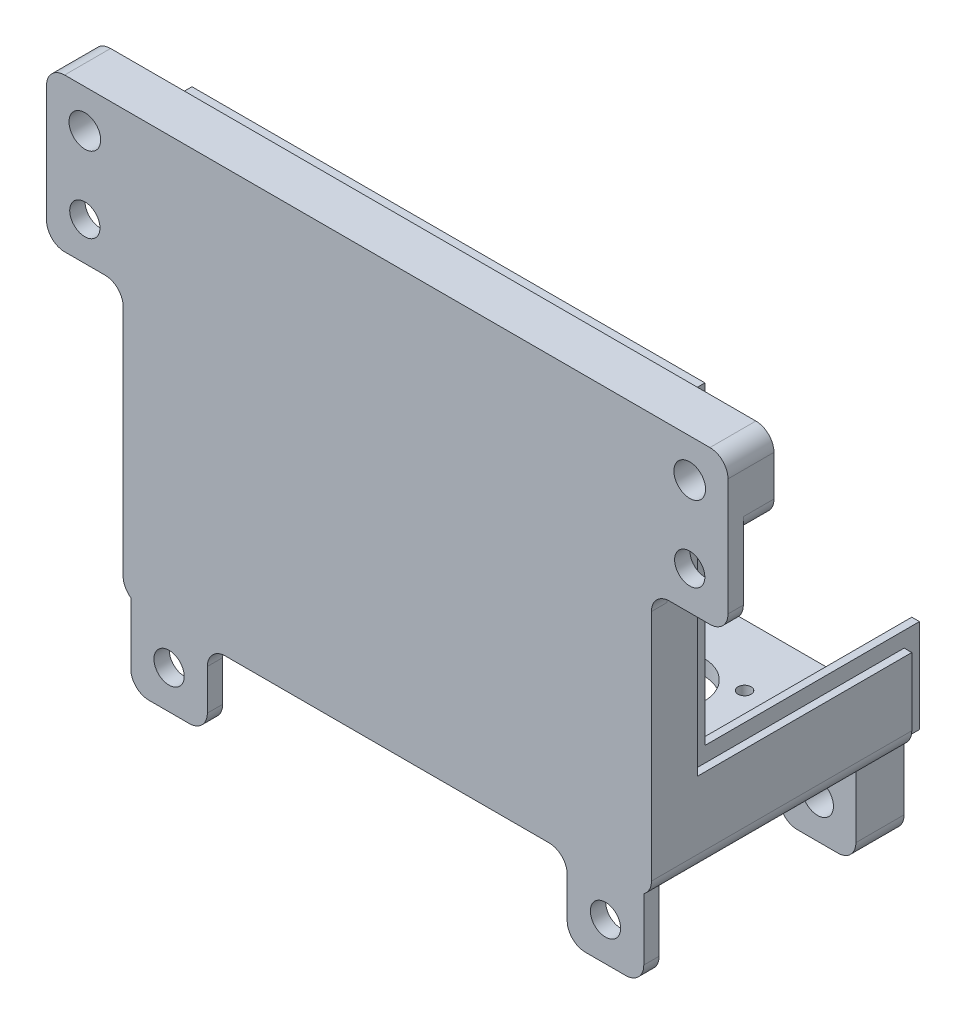
from build123d import *

# Parameters (mm, degrees)
SKETCH1_W           = 82.539998569
SKETCH1_H           = 65.04
BOSS_EXTRUDE1_DEPTH = 43.18
SHELL1_T            = 2.54
SKETCH2_R           = 1.085
CUT_EXTRUDE1_DEPTH  = 124.952130409
FILLET1_R           = 6.20014
FILLET2_R           = 1
SKETCH6_W           = 35.56
SKETCH6_H           = 50.8
CUT_EXTRUDE2_DEPTH  = 124.028758627
SKETCH3_R           = 2.125
BOSS_EXTRUDE2_DEPTH = 9.39038
CUT_EXTRUDE3_DEPTH  = 2.54
SKETCH8_W           = 1.27
SKETCH8_H           = 33.02
CUT_EXTRUDE4_DEPTH  = 2.54
SKETCH10_W          = 87.619998569
SKETCH10_H          = 10.145268184
BOSS_EXTRUDE3_DEPTH = 2.54
CUT_EXTRUDE5_DEPTH  = 2.54
SKETCH11_W          = 12.7
SKETCH11_H          = 8
BOSS_EXTRUDE4_DEPTH = 12.7
SKETCH12_R          = 2.625
CUT_EXTRUDE6_DEPTH  = 127.362400741
SKETCH13_W          = 7.62
SKETCH13_H          = 12.7
BOSS_EXTRUDE5_DEPTH = 12.7
SKETCH14_R          = 2.625
CUT_EXTRUDE7_DEPTH  = 125.717897357
SKETCH15_W          = 12.7
SKETCH15_H          = 12.7
SKETCH15_R          = 2.508000064
BOSS_EXTRUDE6_DEPTH = 2.54
FILLET3_R           = 3


# Some blends are built 0.0001 mm under size
with BuildPart() as part:
    # Sketch1 → Boss-Extrude1 (new body)
    with BuildSketch(Plane.XY):
        with Locations((47.599999189, 40.75)):
            Rectangle(SKETCH1_W, SKETCH1_H)
    extrude(amount=BOSS_EXTRUDE1_DEPTH)

    # Shell1
    shell1_openings = [part.faces().sort_by_distance(p)[0] for p in [
        (47.599999189, 73.27, 21.59),
        (47.599999189, 40.75, 0),
    ]]
    offset(amount=SHELL1_T, openings=shell1_openings, kind=Kind.INTERSECTION)

    # Sketch2 → Cut-Extrude1 (cut, through all)
    with BuildSketch(Plane(origin=(97.099998474, 5.69, 0), x_dir=(0, 0, -1), z_dir=(0, 1, 0))):
        with Locations(Location((-10.166, 73.199999285, 0), (0, 0, 90))):
            Circle(SKETCH2_R)
        with Locations(Location((-10.166, 25.799999285, 0), (0, 0, 90))):
            Circle(SKETCH2_R)
        with Locations(Location((-28.266, 24.299999285, 0), (0, 0, 90))):
            Circle(SKETCH2_R)
        with Locations(Location((-28.266, 74.699999285, 0), (0, 0, 90))):
            Circle(SKETCH2_R)
        Polygon((-33.02, 71.391050497), (-8.912, 71.391050497), (-8.912, 55.244166488), (-6.912, 55.244166488), (-6.912, 43.755832082), (-8.912, 43.755832082), (-8.912, 27.608948073), (-33.02, 27.608948073), align=None)
    extrude(amount=CUT_EXTRUDE1_DEPTH, mode=Mode.SUBTRACT)

    # Fillet1
    fillet1_edges = [part.edges().sort_by_distance(p)[0] for p in [
        (25.708947978, 6.96, 33.02),
        (69.491050401, 6.96, 33.02),
        (69.491050401, 6.96, 8.912),
        (25.708947978, 6.96, 8.912),
    ]]
    fillet(fillet1_edges, radius=FILLET1_R)

    # Fillet2
    fillet2_edges = [part.edges().sort_by_distance(p)[0] for p in [
        (53.344166393, 6.96, 6.912),
        (41.855831986, 6.96, 6.912),
    ]]
    fillet(fillet2_edges, radius=FILLET2_R)
    fillet2_2_edges = [part.edges().sort_by_distance(p)[0] for p in [
        (53.344166393, 6.96, 8.912),
        (41.855831986, 6.96, 8.912),
    ]]
    fillet(fillet2_2_edges, radius=FILLET2_R - 0.0001)  # a hair under: the kernel refuses the full size

    # Sketch6 → Cut-Extrude2 (cut, through all)
    with BuildSketch(Plane.ZY.offset(-3.789999905)):
        with Locations((17.78, 47.87)):
            Rectangle(SKETCH6_W, SKETCH6_H)
    extrude(amount=-CUT_EXTRUDE2_DEPTH, mode=Mode.SUBTRACT)

    # Sketch3 → Boss-Extrude2 (add)
    # profile 1 of 4: a face of its own
    with BuildSketch(Plane(origin=(0, 0, 43.18), x_dir=(-1, 0, 0), z_dir=(0, 0, -1))):
        with BuildLine():
            Line((-86.514394884, 72), (-78.685601874, 72))
            ThreePointArc((-78.685601874, 72), (-78.109870373, 62.509871885), (-87.599998474, 63.085603617))
            Line((-87.599998474, 63.085603617), (-87.599998474, 70.914396383))
            ThreePointArc((-87.599998474, 70.914396383), (-87.090126494, 71.490128006), (-86.514394884, 72))
        make_face()
        with Locations(Location((-82.599998379, 67, 0), (0, 0, 180))):
            Circle(SKETCH3_R, mode=Mode.SUBTRACT)
    # profile 2 of 4: a face of its own
    with BuildSketch(Plane(origin=(0, 0, 43.18), x_dir=(-1, 0, 0), z_dir=(0, 0, -1))):
        with BuildLine():
            Line((-7.599999905, 70.914398454), (-7.599999905, 63.085601546))
            ThreePointArc((-7.599999905, 63.085601546), (-17.090127314, 62.509872815), (-16.514394884, 72))
            Line((-16.514394884, 72), (-8.685601874, 72))
            ThreePointArc((-8.685601874, 72), (-8.109871193, 71.490128936), (-7.599999905, 70.914398454))
        make_face()
        with Locations(Location((-12.599998379, 67, 0), (0, 0, 180))):
            Circle(SKETCH3_R, mode=Mode.SUBTRACT)
    # profile 3 of 4: a face of its own
    with BuildSketch(Plane(origin=(0, 0, 43.18), x_dir=(-1, 0, 0), z_dir=(0, 0, -1))):
        with BuildLine():
            Line((-7.599999905, 20.914398454), (-7.599999905, 13.085601546))
            ThreePointArc((-7.599999905, 13.085601546), (-18.949998379, 17), (-7.599999905, 20.914398454))
        make_face()
        with Locations(Location((-12.599998379, 17, 0), (0, 0, 180))):
            Circle(SKETCH3_R, mode=Mode.SUBTRACT)
    # profile 4 of 4: a face of its own
    with BuildSketch(Plane(origin=(0, 0, 43.18), x_dir=(-1, 0, 0), z_dir=(0, 0, -1))):
        with BuildLine():
            Line((-87.599998474, 20.914396383), (-87.599998474, 13.085603617))
            ThreePointArc((-87.599998474, 13.085603617), (-76.249998379, 17), (-87.599998474, 20.914396383))
        make_face()
        with Locations(Location((-82.599998379, 17, 0), (0, 0, 180))):
            Circle(SKETCH3_R, mode=Mode.SUBTRACT)
    extrude(amount=BOSS_EXTRUDE2_DEPTH)

    # Sketch7 → Cut-Extrude3 (cut)
    with BuildSketch(Plane(origin=(0, 0, 0), x_dir=(-1, 0, 0), z_dir=(0, 0, -1))):
        Polygon((-91.409998474, 22.47), (-90.139998474, 22.47), (-90.139998474, 6.96), (-5.059999905, 6.96), (-5.059999905, 22.47), (-3.789999905, 22.47), (-3.789999905, 5.69), (-91.409998474, 5.69), align=None)
    extrude(amount=-CUT_EXTRUDE3_DEPTH, mode=Mode.SUBTRACT)

    # Sketch8 → Cut-Extrude4 (cut)
    with BuildSketch(Plane(origin=(0, 22.47, 0), x_dir=(1, 0, 0), z_dir=(0, 1, 0))):
        with Locations((4.424999905, -19.05)):
            Rectangle(SKETCH8_W, SKETCH8_H)
        with Locations((90.774998474, -19.05)):
            Rectangle(SKETCH8_W, SKETCH8_H)
    extrude(amount=-CUT_EXTRUDE4_DEPTH, mode=Mode.SUBTRACT)

    # Sketch10 → Boss-Extrude3 (add)
    with BuildSketch(Plane(origin=(0, 73.27, 0), x_dir=(1, 0, 0), z_dir=(0, 1, 0))):
        with Locations((47.59999919, -40.647365908)):
            Rectangle(SKETCH10_W, SKETCH10_H)
    extrude(amount=BOSS_EXTRUDE3_DEPTH)

    # Sketch9 → Cut-Extrude5 (cut)
    with BuildSketch(Plane(origin=(0, 0, 35.56), x_dir=(-1, 0, 0), z_dir=(0, 0, -1))):
        Polygon((-90.139998474, 73.27), (-90.139998474, 74.54), (-5.059999905, 74.54), (-5.059999905, 73.27), (-5.059999905, 19.93), (-3.789999905, 19.93), (-3.789999905, 73.27), (-3.789999905, 75.81), (-91.409998474, 75.81), (-91.409998474, 73.27), (-91.409998474, 19.93), (-90.139998474, 19.93), align=None)
    extrude(amount=-CUT_EXTRUDE5_DEPTH, mode=Mode.SUBTRACT)

    # Sketch11 → Boss-Extrude4 (add)
    with BuildSketch(Plane.XZ.offset(-5.69)):
        with Locations((83.789998474, 6.54)):
            Rectangle(SKETCH11_W, SKETCH11_H)
        with Locations((11.409999905, 6.54)):
            Rectangle(SKETCH11_W, SKETCH11_H)
    extrude(amount=BOSS_EXTRUDE4_DEPTH)

    # Sketch12 → Cut-Extrude6 (cut, through all)
    with BuildSketch(Plane(origin=(0, 0, 2.54), x_dir=(-1, 0, 0), z_dir=(0, 0, -1))):
        with Locations((-83.789998474, -0.66)):
            Circle(SKETCH12_R)
        with Locations((-11.409999905, -0.66)):
            Circle(SKETCH12_R)
    extrude(amount=-CUT_EXTRUDE6_DEPTH, mode=Mode.SUBTRACT)

    # Sketch13 → Boss-Extrude5 (add)
    with BuildSketch(Plane.ZY.offset(-3.789999905)):
        with Locations((41.91, 69.46)):
            Rectangle(SKETCH13_W, SKETCH13_H)
    boss_extrude5 = extrude(amount=BOSS_EXTRUDE5_DEPTH)

    # Sketch14 → Cut-Extrude7 (cut, through all)
    with BuildSketch(Plane(origin=(0, 0, 38.1), x_dir=(-1, 0, 0), z_dir=(0, 0, -1))):
        with Locations(Location((2.560000095, 69.46, 0), (0, 0, 90))):
            Circle(SKETCH14_R)
    cut_extrude7 = extrude(amount=-CUT_EXTRUDE7_DEPTH, mode=Mode.SUBTRACT)

    # Mirror1: Boss-Extrude5, Cut-Extrude7 across plane
    add(boss_extrude5.mirror(Plane.ZY.offset(-47.599999189)))
    add(cut_extrude7.mirror(Plane.ZY.offset(-47.599999189)), mode=Mode.SUBTRACT)

    # Sketch15 → Boss-Extrude6 (add)
    # profile 1 of 4: a face of its own
    with BuildSketch(Plane.XY.offset(45.72)):
        with Locations((11.409999905, -0.66)):
            Rectangle(SKETCH15_W, SKETCH15_H)
        with Locations((11.409999905, -0.66)):
            Circle(SKETCH15_R, mode=Mode.SUBTRACT)
    # profile 2 of 4: a face of its own
    with BuildSketch(Plane.XY.offset(45.72)):
        with Locations((83.789998474, -0.66)):
            Rectangle(SKETCH15_W, SKETCH15_H)
        with Locations((83.789998474, -0.66)):
            Circle(SKETCH15_R, mode=Mode.SUBTRACT)
    # profile 3 of 4: a face of its own
    with BuildSketch(Plane.XY.offset(45.72)):
        with Locations((-2.560000095, 56.76)):
            Rectangle(SKETCH15_W, SKETCH15_H)
        with Locations((-2.560000095, 56.76)):
            Circle(SKETCH15_R, mode=Mode.SUBTRACT)
    # profile 4 of 4: a face of its own
    with BuildSketch(Plane.XY.offset(45.72)):
        with Locations((97.759998474, 56.76)):
            Rectangle(SKETCH15_W, SKETCH15_H)
        with Locations((97.759998474, 56.76)):
            Circle(SKETCH15_R, mode=Mode.SUBTRACT)
    extrude(amount=-BOSS_EXTRUDE6_DEPTH)

    # Fillet3
    # the kernel refuses this fillet: 3 mm, written as the material it adds along each edge
    with BuildSketch(Plane(origin=(6.329999905, 73.27, 35.574731816), x_dir=(1, 0, 0), z_dir=(0, 0, 1))) as fillet3_piece_1:
        with BuildLine():
            CenterArc((FILLET3_R, -FILLET3_R), FILLET3_R, 90, 90)
            Line((0, -FILLET3_R), (0, 0))
            Line((0, 0), (FILLET3_R, 0))
        make_face()
    extrude(amount=7.605268184)
    with BuildSketch(Plane(origin=(88.869998474, 73.27, 35.574731816), x_dir=(-1, 0, 0), z_dir=(0, 0, 1))) as fillet3_piece_2:
        with BuildLine():
            CenterArc((FILLET3_R, FILLET3_R), FILLET3_R, 180, 90)
            Line((0, FILLET3_R), (0, 0))
            Line((0, 0), (FILLET3_R, 0))
        make_face()
    extrude(amount=7.605268184)
    with BuildSketch(Plane(origin=(88.869998474, 8.23, 0), x_dir=(-1, 0, 0), z_dir=(0, 0, 1))) as fillet3_piece_3:
        with BuildLine():
            CenterArc((FILLET3_R, -FILLET3_R), FILLET3_R, 90, 90)
            Line((0, -FILLET3_R), (0, 0))
            Line((0, 0), (FILLET3_R, 0))
        make_face()
    extrude(amount=43.18)
    with BuildSketch(Plane(origin=(6.329999905, 8.23, 0), x_dir=(1, 0, 0), z_dir=(0, 0, 1))) as fillet3_piece_4:
        with BuildLine():
            CenterArc((FILLET3_R, FILLET3_R), FILLET3_R, 180, 90)
            Line((0, FILLET3_R), (0, 0))
            Line((0, 0), (FILLET3_R, 0))
        make_face()
    extrude(amount=43.18)
    with BuildSketch(Plane(origin=(3.789999905, 63.11, 43.18), x_dir=(-1, 0, 0), z_dir=(0, 0, -1))) as fillet3_piece_5:
        with BuildLine():
            CenterArc((FILLET3_R, -FILLET3_R), FILLET3_R, 90, 90)
            Line((0, -FILLET3_R), (0, 0))
            Line((0, 0), (FILLET3_R, 0))
        make_face()
    extrude(amount=5.08)
    with BuildSketch(Plane(origin=(3.789999905, 50.41, 45.72), x_dir=(-1, 0, 0), z_dir=(0, 0, -1)), Plane(origin=(77.439998474, 5.69, 45.72), x_dir=(-1, 0, 0), z_dir=(0, 0, -1))) as fillet3_piece_6:
        with BuildLine():
            CenterArc((FILLET3_R, -FILLET3_R), FILLET3_R, 90, 90)
            Line((0, -FILLET3_R), (0, 0))
            Line((0, 0), (FILLET3_R, 0))
        make_face()
    extrude(amount=2.54)
    with BuildSketch(Plane(origin=(17.759999905, 5.69, 10.54), x_dir=(1, 0, 0), z_dir=(0, 0, -1))) as fillet3_piece_7:
        with BuildLine():
            CenterArc((FILLET3_R, FILLET3_R), FILLET3_R, 180, 90)
            Line((0, FILLET3_R), (0, 0))
            Line((0, 0), (FILLET3_R, 0))
        make_face()
    extrude(amount=8)
    with BuildSketch(Plane(origin=(77.439998474, 5.69, 10.54), x_dir=(-1, 0, 0), z_dir=(0, 0, -1))) as fillet3_piece_8:
        with BuildLine():
            CenterArc((FILLET3_R, -FILLET3_R), FILLET3_R, 90, 90)
            Line((0, -FILLET3_R), (0, 0))
            Line((0, 0), (FILLET3_R, 0))
        make_face()
    extrude(amount=8)
    with BuildSketch(Plane(origin=(17.759999905, 5.69, 45.72), x_dir=(1, 0, 0), z_dir=(0, 0, -1)), Plane(origin=(91.409998474, 50.41, 45.72), x_dir=(1, 0, 0), z_dir=(0, 0, -1))) as fillet3_piece_9:
        with BuildLine():
            CenterArc((FILLET3_R, FILLET3_R), FILLET3_R, 180, 90)
            Line((0, FILLET3_R), (0, 0))
            Line((0, 0), (FILLET3_R, 0))
        make_face()
    extrude(amount=2.54)
    with BuildSketch(Plane(origin=(91.409998474, 63.11, 43.18), x_dir=(1, 0, 0), z_dir=(0, 0, -1))) as fillet3_piece_10:
        with BuildLine():
            CenterArc((FILLET3_R, FILLET3_R), FILLET3_R, 180, 90)
            Line((0, FILLET3_R), (0, 0))
            Line((0, 0), (FILLET3_R, 0))
        make_face()
    extrude(amount=5.08)
    # the kernel refuses this fillet: 3 mm, written as the material it takes off along each edge
    with BuildSketch(Plane(origin=(-8.910000095, 75.81, 30.6), x_dir=(1, 0, 0), z_dir=(0, 0, 1)), Plane(origin=(104.109998474, 75.81, 30.6), x_dir=(0, -1, 0), z_dir=(0, 0, 1))) as fillet3_2_piece_1:
        with BuildLine():
            CenterArc((FILLET3_R, -FILLET3_R), FILLET3_R, 90, 90)
            Line((0, -FILLET3_R), (0, 0))
            Line((0, 0), (FILLET3_R, 0))
        make_face()
    extrude(amount=22.62, mode=Mode.SUBTRACT)
    with BuildSketch(Plane(origin=(-8.910000095, 63.11, 43.18), x_dir=(0, 1, 0), z_dir=(0, 0, -1)), Plane(origin=(104.109998474, 63.11, 43.18), x_dir=(-1, 0, 0), z_dir=(0, 0, -1))) as fillet3_2_piece_2:
        with BuildLine():
            CenterArc((FILLET3_R, FILLET3_R), FILLET3_R, 180, 90)
            Line((0, FILLET3_R), (0, 0))
            Line((0, 0), (FILLET3_R, 0))
        make_face()
    extrude(amount=12.58, mode=Mode.SUBTRACT)
    with BuildSketch(Plane(origin=(-8.910000095, 50.41, 53.22), x_dir=(0, 1, 0), z_dir=(0, 0, -1)), Plane(origin=(17.759999905, -7.01, 53.22), x_dir=(-1, 0, 0), z_dir=(0, 0, -1)), Plane(origin=(5.059999905, -7.01, 53.22), x_dir=(0, 1, 0), z_dir=(0, 0, -1)), Plane(origin=(77.439998474, -7.01, 53.22), x_dir=(0, 1, 0), z_dir=(0, 0, -1)), Plane(origin=(90.139998474, -7.01, 53.22), x_dir=(-1, 0, 0), z_dir=(0, 0, -1)), Plane(origin=(104.109998474, 50.41, 53.22), x_dir=(-1, 0, 0), z_dir=(0, 0, -1))) as fillet3_2_piece_3:
        with BuildLine():
            CenterArc((FILLET3_R, FILLET3_R), FILLET3_R, 180, 90)
            Line((0, FILLET3_R), (0, 0))
            Line((0, 0), (FILLET3_R, 0))
        make_face()
    extrude(amount=17.54, mode=Mode.SUBTRACT)
    with BuildSketch(Plane(origin=(17.759999905, -7.01, 18.04), x_dir=(0, 1, 0), z_dir=(0, 0, -1)), Plane(origin=(77.439998474, -7.01, 18.04), x_dir=(1, 0, 0), z_dir=(0, 0, -1))) as fillet3_2_piece_4:
        with BuildLine():
            CenterArc((FILLET3_R, -FILLET3_R), FILLET3_R, 90, 90)
            Line((0, -FILLET3_R), (0, 0))
            Line((0, 0), (FILLET3_R, 0))
        make_face()
    extrude(amount=23, mode=Mode.SUBTRACT)
    with BuildSketch(Plane(origin=(5.059999905, -7.01, -4.96), x_dir=(1, 0, 0), z_dir=(0, 0, 1)), Plane(origin=(90.139998474, -7.01, -4.96), x_dir=(0, 1, 0), z_dir=(0, 0, 1))) as fillet3_2_piece_5:
        with BuildLine():
            CenterArc((FILLET3_R, FILLET3_R), FILLET3_R, 180, 90)
            Line((0, FILLET3_R), (0, 0))
            Line((0, 0), (FILLET3_R, 0))
        make_face()
    extrude(amount=23, mode=Mode.SUBTRACT)
    with BuildSketch(Plane(origin=(3.789999905, 5.69, 53.22), x_dir=(1, 0, 0), z_dir=(0, 0, -1))) as fillet3_2_piece_6_section:
        with BuildLine():
            CenterArc((FILLET3_R, -FILLET3_R), FILLET3_R, 90, 90)
            Line((0, -FILLET3_R), (0, 0))
            Line((0, 0), (FILLET3_R, 0))
        make_face()
    fillet3_2_piece_6 = extrude(amount=58.18, mode=Mode.PRIVATE)
    fillet3_2_piece_6 = split(fillet3_2_piece_6, bisect_by=Plane(origin=(5.059999905, 6.455077562, 44.45), z_dir=(-1, 0, 0)), keep=Keep.TOP, mode=Mode.PRIVATE)
    add(fillet3_2_piece_6, mode=Mode.SUBTRACT)
    with BuildSketch(Plane(origin=(3.789999905, 5.69, 53.22), x_dir=(1, 0, 0), z_dir=(0, 0, -1))) as fillet3_2_piece_7_section:
        with BuildLine():
            CenterArc((FILLET3_R, -FILLET3_R), FILLET3_R, 90, 90)
            Line((0, -FILLET3_R), (0, 0))
            Line((0, 0), (FILLET3_R, 0))
        make_face()
    fillet3_2_piece_7 = extrude(amount=58.18, mode=Mode.PRIVATE)
    fillet3_2_piece_7 = split(fillet3_2_piece_7, bisect_by=Plane(origin=(5.484184681, 5.851767766, 10.54), z_dir=(0, 0, 1)), keep=Keep.TOP, mode=Mode.PRIVATE)
    fillet3_2_piece_7 = split(fillet3_2_piece_7, bisect_by=Plane(origin=(5.484184681, 5.851767766, 43.18), z_dir=(0, 0, -1)), keep=Keep.TOP, mode=Mode.PRIVATE)
    add(fillet3_2_piece_7, mode=Mode.SUBTRACT)
    with BuildSketch(Plane(origin=(91.409998474, 5.69, 53.22), x_dir=(-1, 0, 0), z_dir=(0, 0, -1))) as fillet3_2_piece_8_section:
        with BuildLine():
            CenterArc((FILLET3_R, FILLET3_R), FILLET3_R, 180, 90)
            Line((0, FILLET3_R), (0, 0))
            Line((0, 0), (FILLET3_R, 0))
        make_face()
    fillet3_2_piece_8 = extrude(amount=58.18, mode=Mode.PRIVATE)
    fillet3_2_piece_8 = split(fillet3_2_piece_8, bisect_by=Plane(origin=(90.139998474, 6.455077562, 44.45), z_dir=(1, 0, 0)), keep=Keep.TOP, mode=Mode.PRIVATE)
    add(fillet3_2_piece_8, mode=Mode.SUBTRACT)
    with BuildSketch(Plane(origin=(91.409998474, 5.69, 53.22), x_dir=(-1, 0, 0), z_dir=(0, 0, -1))) as fillet3_2_piece_9_section:
        with BuildLine():
            CenterArc((FILLET3_R, FILLET3_R), FILLET3_R, 180, 90)
            Line((0, FILLET3_R), (0, 0))
            Line((0, 0), (FILLET3_R, 0))
        make_face()
    fillet3_2_piece_9 = extrude(amount=58.18, mode=Mode.PRIVATE)
    fillet3_2_piece_9 = split(fillet3_2_piece_9, bisect_by=Plane(origin=(89.715813698, 5.851767766, 10.54), z_dir=(0, 0, 1)), keep=Keep.TOP, mode=Mode.PRIVATE)
    fillet3_2_piece_9 = split(fillet3_2_piece_9, bisect_by=Plane(origin=(89.715813698, 5.851767766, 43.18), z_dir=(0, 0, -1)), keep=Keep.TOP, mode=Mode.PRIVATE)
    add(fillet3_2_piece_9, mode=Mode.SUBTRACT)


solid = part.part
